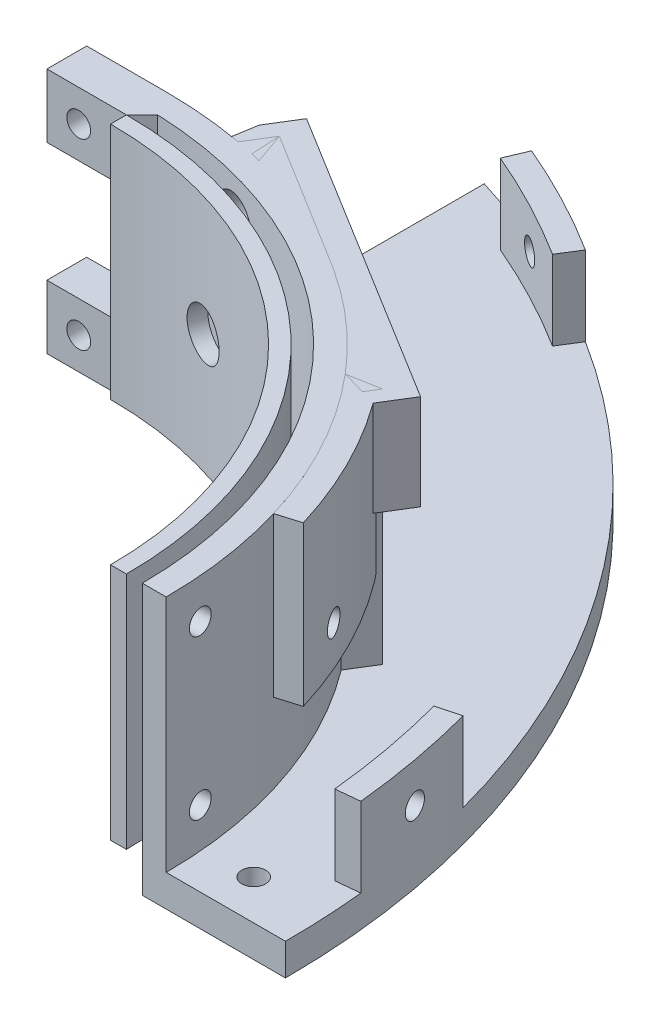
from build123d import *
from build123d.topology import SkipClean

# Parameters (mm, degrees)
BOSS_EXTRUDE1_DEPTH                  = 15
BOSS_EXTRUDE3_DEPTH                  = 15
BOSS_EXTRUDE4_REACH                  = 66.59
BOSS_EXTRUDE4_END_RADIUS             = 52
SKETCH2_R                            = 3.9
BOSS_EXTRUDE4_DIRECTION_2_REACH      = 66.59
BOSS_EXTRUDE4_DIRECTION_2_END_RADIUS = 50
BOSS_EXTRUDE5_REACH                  = 61.954
BOSS_EXTRUDE5_END_RADIUS             = 52
SKETCH4_R                            = 5.6
BOSS_EXTRUDE5_DIRECTION_2_REACH      = 61.954
BOSS_EXTRUDE5_DIRECTION_2_END_RADIUS = 50
CUT_EXTRUDE1_DEPTH                   = 65.589910379
CUT_EXTRUDE1_DEPTH_BACK              = 65.589910379
SKETCH5_R                            = 1.5
SKETCH6_R                            = 3
CUT_EXTRUDE2_DEPTH                   = 65.589910379
CUT_EXTRUDE3_DEPTH                   = 60.953724142
CUT_EXTRUDE3_DEPTH_BACK              = 60.953724142
SKETCH7_R                            = 1.5
SKETCH8_R                            = 3
CUT_EXTRUDE4_DEPTH                   = 60.953724142
BOSS_EXTRUDE6_START                  = -4
BOSS_EXTRUDE6_DEPTH                  = 4
SKETCH12_R                           = 1.5
CUT_EXTRUDE6_DEPTH                   = 92.433035695
BOSS_EXTRUDE7_DEPTH                  = 10
CUT_EXTRUDE10_REACH                  = 106.962
CUT_EXTRUDE10_END_RADIUS             = 96.464285714
SKETCH21_R                           = 1.5
CUT_EXTRUDE11_REACH                  = 106.962
CUT_EXTRUDE11_END_RADIUS             = 96.464285714
SKETCH22_R                           = 1.5
BOSS_EXTRUDE8_DEPTH                  = 20
CUT_EXTRUDE12_REACH                  = 77.845
CUT_EXTRUDE12_END_RADIUS             = 58
SKETCH24_R                           = 1.5
CUT_EXTRUDE13_REACH                  = 92.348
CUT_EXTRUDE13_END_RADIUS             = 58
SKETCH25_R                           = 1.5
BOSS_EXTRUDE9_DEPTH                  = 12
SKETCH28_R                           = 1
CUT_EXTRUDE14_DEPTH                  = 90.439608754
CUT_EXTRUDE15_REACH                  = 93.44
CUT_EXTRUDE15_END_RADIUS             = 55
CUT_EXTRUDE15_START                  = -2
SKETCH29_R                           = 2.5
SKETCH30_W                           = 5
SKETCH30_H                           = 8
BOSS_EXTRUDE10_DEPTH                 = 10
SKETCH31_R                           = 1.5
CUT_EXTRUDE16_DEPTH                  = 5
SKETCH32_R                           = 3
CUT_EXTRUDE17_DEPTH                  = 2
BOSS_EXTRUDE11_START                 = -34
BOSS_EXTRUDE11_DEPTH                 = 34
CUT_EXTRUDE18_DEPTH                  = 87.977008614
SKETCH34_W                           = 20.490980368
SKETCH34_H                           = 15
CUT_EXTRUDE19_DEPTH                  = 90.246848842
FILLET1_R                            = 7.5
CHAMFER1_SIZE                        = 2
SKETCH36_R                           = 1.5
CUT_EXTRUDE20_DEPTH                  = 83.41834451
CUT_EXTRUDE21_REACH                  = 90.764
CUT_EXTRUDE21_END_RADIUS             = 52
SKETCH38_R                           = 1.5
CUT_EXTRUDE22_REACH                  = 93.764
CUT_EXTRUDE22_END_RADIUS             = 52
CUT_EXTRUDE22_START                  = -3
SKETCH39_R                           = 3


# Some blends are built 0.0001 mm under size
with BuildPart() as part:
    # Sketch1 → Boss-Extrude1 (new, symmetric)
    with BuildSketch(Plane(origin=(0, 0, 0), x_dir=(1, 0, 0), z_dir=(0, 1, 0))):
        with BuildLine():
            Line((0, 0), (0, 2))
            ThreePointArc((0, 2), (35.355339059, -12.644660941), (50, -48))
            Line((50, -48), (48, -48))
            ThreePointArc((48, -48), (33.941125497, -14.058874503), (0, 0))
        make_face()
    extrude(amount=BOSS_EXTRUDE1_DEPTH, both=True)

    # Boss-Extrude4: up to this cylinder (the profile starts inside it)
    boss_extrude4_end = Plane(origin=(0, 0, 48), z_dir=(0, -1, 0)) * Cylinder(BOSS_EXTRUDE4_END_RADIUS, 238.18, mode=Mode.PRIVATE)
    # Sketch2 → Boss-Extrude4 (add, up to the surface)
    with BuildSketch(Plane(origin=(14.346758998, 0, 0.1025), x_dir=(-0.9579500000000001, 0, -0.2869351799623044), z_dir=(0.28693517996230433, 0, -0.95795)), mode=Mode.PRIVATE) as boss_extrude4_sk1:
        with Locations(Location((0, 0, 0), (0, 0, 180))):
            Circle(SKETCH2_R)
    boss_extrude4_tool1 = extrude(boss_extrude4_sk1.sketch, amount=BOSS_EXTRUDE4_REACH, mode=Mode.PRIVATE) & boss_extrude4_end
    add(boss_extrude4_tool1.solids().sort_by_distance((14.346759, 0, 0.1025))[0])

    # Boss-Extrude4 direction 2: up to this cylinder (the profile starts outside it)
    with SkipClean():  # the faces are left unmerged after this step: merging them gives an invalid solid
        boss_extrude4_direction_2_end = Plane(origin=(0, 0, 48), z_dir=(0, -1, 0)) * Cylinder(BOSS_EXTRUDE4_DIRECTION_2_END_RADIUS, 234.18, mode=Mode.PRIVATE)
        # Sketch2 → Boss-Extrude4 direction 2 (add, up to the surface)
        with BuildSketch(Plane(origin=(14.346758998, 0, 0.1025), x_dir=(-0.9579500000000001, 0, -0.2869351799623044), z_dir=(0.28693517996230433, 0, -0.95795)), mode=Mode.PRIVATE) as boss_extrude4_direction_2_sk1:
            with Locations(Location((0, 0, 0), (0, 0, 180))):
                Circle(SKETCH2_R)
        boss_extrude4_direction_2_tool1 = extrude(boss_extrude4_direction_2_sk1.sketch, amount=-BOSS_EXTRUDE4_DIRECTION_2_REACH, mode=Mode.PRIVATE) - boss_extrude4_direction_2_end
        add(boss_extrude4_direction_2_tool1.solids().sort_by_distance((14.346759, 0, 0.1025))[0])
        add(boss_extrude4_direction_2_tool1.solids().sort_by_distance((14.346759, 0, 0.1025))[1])

    # Boss-Extrude5: up to this cylinder (the profile starts inside it)
    boss_extrude5_end = Plane(origin=(0, 0, 48), z_dir=(0, -1, 0)) * Cylinder(BOSS_EXTRUDE5_END_RADIUS, 228.908, mode=Mode.PRIVATE)
    # Sketch4 → Boss-Extrude5 (add, up to the surface)
    with BuildSketch(Plane(origin=(46, 0, 28.404082058), x_dir=(-0.3919183588453085, 0, -0.92), z_dir=(0.9199999999999999, 0, -0.39191835884530846)), mode=Mode.PRIVATE) as boss_extrude5_sk1:
        with Locations(Location((0, 0, 0), (0, 0, 180))):
            Circle(SKETCH4_R)
    boss_extrude5_tool1 = extrude(boss_extrude5_sk1.sketch, amount=BOSS_EXTRUDE5_REACH, mode=Mode.PRIVATE) & boss_extrude5_end
    add(boss_extrude5_tool1.solids().sort_by_distance((46, 0, 28.404082))[0])

    # Boss-Extrude5 direction 2: up to this cylinder (the profile starts outside it)
    boss_extrude5_direction_2_end = Plane(origin=(0, 0, 48), z_dir=(0, -1, 0)) * Cylinder(BOSS_EXTRUDE5_DIRECTION_2_END_RADIUS, 224.908, mode=Mode.PRIVATE)
    # Sketch4 → Boss-Extrude5 direction 2 (add, up to the surface)
    with BuildSketch(Plane(origin=(46, 0, 28.404082058), x_dir=(-0.3919183588453085, 0, -0.92), z_dir=(0.9199999999999999, 0, -0.39191835884530846)), mode=Mode.PRIVATE) as boss_extrude5_direction_2_sk1:
        with Locations(Location((0, 0, 0), (0, 0, 180))):
            Circle(SKETCH4_R)
    boss_extrude5_direction_2_tool1 = extrude(boss_extrude5_direction_2_sk1.sketch, amount=-BOSS_EXTRUDE5_DIRECTION_2_REACH, mode=Mode.PRIVATE) - boss_extrude5_direction_2_end
    add(boss_extrude5_direction_2_tool1.solids().sort_by_distance((46, 0, 28.404082))[0])
    add(boss_extrude5_direction_2_tool1.solids().sort_by_distance((46, 0, 28.404082))[1])

    # Sketch5 → Cut-Extrude1 (cut, two sides: drawn at the far end of the back side and taken through both)
    with BuildSketch(Plane(origin=(14.346758998, 0, 0.1025), x_dir=(-0.9579500000000001, 0, -0.2869351799623044), z_dir=(0.28693517996230433, 0, -0.95795)).offset(-CUT_EXTRUDE1_DEPTH_BACK)):
        Circle(SKETCH5_R)
    extrude(amount=CUT_EXTRUDE1_DEPTH + CUT_EXTRUDE1_DEPTH_BACK, mode=Mode.SUBTRACT)

    # Sketch6 → Cut-Extrude2 (cut, through all)
    with BuildSketch(Plane(origin=(14.346758998, 0, 0.1025), x_dir=(-0.9579500000000001, 0, -0.2869351799623044), z_dir=(0.28693517996230433, 0, -0.95795))):
        Circle(SKETCH6_R)
    extrude(amount=-CUT_EXTRUDE2_DEPTH, mode=Mode.SUBTRACT)

    # Sketch7 → Cut-Extrude3 (cut, two sides: drawn at the far end of the back side and taken through both)
    with BuildSketch(Plane(origin=(46, 0, 28.404082058), x_dir=(-0.3919183588453085, 0, -0.92), z_dir=(0.9199999999999999, 0, -0.39191835884530846)).offset(-CUT_EXTRUDE3_DEPTH_BACK)):
        Circle(SKETCH7_R)
    extrude(amount=CUT_EXTRUDE3_DEPTH + CUT_EXTRUDE3_DEPTH_BACK, mode=Mode.SUBTRACT)

    # Sketch8 → Cut-Extrude4 (cut, through all)
    with BuildSketch(Plane(origin=(46, 0, 28.404082058), x_dir=(-0.3919183588453085, 0, -0.92), z_dir=(0.9199999999999999, 0, -0.39191835884530846))):
        Circle(SKETCH8_R)
    extrude(amount=-CUT_EXTRUDE4_DEPTH, mode=Mode.SUBTRACT)


with BuildPart() as body_2:
    # Sketch3 → Boss-Extrude3 (new, symmetric)
    with BuildSketch(Plane(origin=(0, 0, 0), x_dir=(1, 0, 0), z_dir=(0, 1, 0))):
        with BuildLine():
            Line((0, 4), (0, 7))
            ThreePointArc((0, 7), (38.890872965, -9.109127035), (55, -48))
            Line((55, -48), (52, -48))
            ThreePointArc((52, -48), (36.769552622, -11.230447378), (0, 4))
        make_face()
    extrude(amount=BOSS_EXTRUDE3_DEPTH, both=True)

    # Sketch9 → Boss-Extrude6 (add)
    with BuildSketch(Plane(origin=(0, -15, 0), x_dir=(1, 0, 0), z_dir=(0, 1, 0)).offset(BOSS_EXTRUDE6_START)):
        with BuildLine():
            Line((0, 4), (0, 47))
            ThreePointArc((0, 47), (50.610018108, 11.002118606), (70, -48))
            Line((70, -48), (52, -48))
            ThreePointArc((52, -48), (36.769552622, -11.230447378), (0, 4))
        make_face()
    extrude(amount=BOSS_EXTRUDE6_DEPTH)

    # Sketch12 → Cut-Extrude6 (cut, through all)
    with BuildSketch(Plane(origin=(0, -19, 0), x_dir=(1, 0, 0), z_dir=(0, 1, 0))):
        with Locations(Location((5, 25.5, 0), (0, 0, 90))):
            Circle(SKETCH12_R)
        with Locations(Location((61, -43, 0), (0, 0, 90))):
            Circle(SKETCH12_R)
    extrude(amount=CUT_EXTRUDE6_DEPTH, mode=Mode.SUBTRACT)

    # Sketch19 → Boss-Extrude7 (add)
    with BuildSketch(Plane.XZ.offset(15)):
        with BuildLine():
            Line((69.497307002, 38.012643005), (66.512469017, 38.313877471))
            ThreePointArc((66.512469017, 38.313877471), (65.422459077, 30.625763866), (63.717618824, 23.050228757))
            Line((63.717618824, 23.050228757), (66.615538106, 22.274301033))
            ThreePointArc((66.615538106, 22.274301033), (68.373398197, 30.085432198), (69.497307002, 38.012643005))
        make_face()
        with BuildLine():
            Line((8.218266739, -40.799682764), (9.390178773, -43.561316734))
            ThreePointArc((9.390178773, -43.561316734), (16.628654889, -40.139576577), (23.568466137, -36.146725211))
            Line((23.568466137, -36.146725211), (21.968914555, -33.608727036))
            ThreePointArc((21.968914555, -33.608727036), (15.238418979, -37.481147696), (8.218266739, -40.799682764))
        make_face()
    extrude(amount=-BOSS_EXTRUDE7_DEPTH)

    # Cut-Extrude10: up to this cylinder (the profile starts outside it)
    cut_extrude10_end = Plane(origin=(-29.464285714, -10, 48), z_dir=(0, -1, 0)) * Cylinder(CUT_EXTRUDE10_END_RADIUS, 407.852571429, mode=Mode.PRIVATE)
    # Sketch21 → Cut-Extrude10 (cut, up to the surface)
    with BuildSketch(Plane(origin=(16.628654889, -5, -40.139576577), x_dir=(-0.8861429602003462, 0, -0.463411970159779), z_dir=(0.463411970159779, 0, -0.8861429602003462)), mode=Mode.PRIVATE) as cut_extrude10_sk1:
        with Locations((0, -5)):
            Circle(SKETCH21_R)
    cut_extrude10_tool1 = extrude(cut_extrude10_sk1.sketch, amount=-CUT_EXTRUDE10_REACH, mode=Mode.PRIVATE) - cut_extrude10_end
    add(cut_extrude10_tool1.solids().sort_by_distance((16.628655, -10, -40.139577))[0], mode=Mode.SUBTRACT)

    # Cut-Extrude11: up to this cylinder (the profile starts outside it)
    cut_extrude11_end = Plane(origin=(-29.464285714, -10, 48), z_dir=(0, -1, 0)) * Cylinder(CUT_EXTRUDE11_END_RADIUS, 407.852571429, mode=Mode.PRIVATE)
    # Sketch22 → Cut-Extrude11 (cut, up to the surface)
    with BuildSketch(Plane(origin=(68.373398197, -5, 30.085432198), x_dir=(-0.18011055599990136, 0, -0.9836463732548434), z_dir=(0.9836463732548434, 0, -0.18011055599990136)), mode=Mode.PRIVATE) as cut_extrude11_sk1:
        with Locations((0, -5)):
            Circle(SKETCH22_R)
    cut_extrude11_tool1 = extrude(cut_extrude11_sk1.sketch, amount=-CUT_EXTRUDE11_REACH, mode=Mode.PRIVATE) - cut_extrude11_end
    add(cut_extrude11_tool1.solids().sort_by_distance((68.373398, -10, 30.085432))[0], mode=Mode.SUBTRACT)

    # Sketch30 → Boss-Extrude10 (add)
    with BuildSketch(Plane.ZY):
        with Locations((-4.5, 11)):
            Rectangle(SKETCH30_W, SKETCH30_H)
        with Locations((-4.5, -12)):
            Rectangle(SKETCH30_W, SKETCH30_H)
    extrude(amount=BOSS_EXTRUDE10_DEPTH)

    # Sketch31 → Cut-Extrude16 (cut)
    with BuildSketch(Plane(origin=(0, 0, -7), x_dir=(-1, 0, 0), z_dir=(0, 0, -1))):
        with Locations((6, 11)):
            Circle(SKETCH31_R)
        with Locations((6, -12)):
            Circle(SKETCH31_R)
    extrude(amount=-CUT_EXTRUDE16_DEPTH, mode=Mode.SUBTRACT)

    # Sketch32 → Cut-Extrude17 (cut)
    with BuildSketch(Plane(origin=(0, 0, -7), x_dir=(-1, 0, 0), z_dir=(0, 0, -1))):
        with Locations((6, 11)):
            Circle(SKETCH32_R)
        with Locations((6, -12)):
            Circle(SKETCH32_R)
    extrude(amount=-CUT_EXTRUDE17_DEPTH, mode=Mode.SUBTRACT)

    # Sketch37 → Boss-Extrude11 (add)
    with BuildSketch(Plane(origin=(0, 15, 0), x_dir=(1, 0, 0), z_dir=(0, 1, 0)).offset(BOSS_EXTRUDE11_START)):
        with BuildLine():
            Line((45.952291522, -11.759319765), (28.946256445, -1.233406818))
            ThreePointArc((28.946256445, -1.233406818), (37.098925323, -7.396185649), (43.97065903, -14.960914897))
            Line((43.97065903, -14.960914897), (45.952291522, -11.759319765))
        make_face()
        with BuildLine():
            Line((28.946256445, -1.233406818), (11.940224446, 9.292504223))
            Line((11.940224446, 9.292504223), (9.958591955, 6.090909091))
            ThreePointArc((9.958591955, 6.090909091), (19.794145804, 3.31463526), (28.946256445, -1.233406818))
        make_face()
    extrude(amount=BOSS_EXTRUDE11_DEPTH)

    # Sketch33 → Cut-Extrude18 (cut, through all)
    with BuildSketch(Plane.ZY):
        Polygon((-7, 7), (-4, 7), (-4, -8), (-7, -8), (-9.292504223, -8), (-9.292504223, 7), align=None)
    extrude(amount=-CUT_EXTRUDE18_DEPTH, mode=Mode.SUBTRACT)

    # Sketch34 → Cut-Extrude19 (cut, through all)
    with BuildSketch(Plane(origin=(0, 0, -4), x_dir=(-1, 0, 0), z_dir=(0, 0, -1))):
        with Locations((-10.245490184, -0.5)):
            Rectangle(SKETCH34_W, SKETCH34_H)
    extrude(amount=-CUT_EXTRUDE19_DEPTH, mode=Mode.SUBTRACT)

    # Fillet1
    fillet1_edges = [body_2.edges().sort_by_distance(p)[0] for p in [
        (20.490980368, 7, -1.896232567),
        (20.490980368, -8, -1.896232567),
    ]]
    fillet(fillet1_edges, radius=FILLET1_R - 0.0001)  # a hair under: the kernel refuses the full size

    # Chamfer1
    # the kernel refuses this chamfer: 2 mm, written as the material it adds along each edge
    with BuildSketch(Plane(origin=(0, -16, -4), x_dir=(0.9998217991483124, -5.3084090101683784e-15, 0.018877763316446326), z_dir=(0, 1, 0)), Plane(origin=(0, 7, -4), x_dir=(0.9998217991483123, -5.3084090101683784e-15, 0.01887776331644899), z_dir=(0, 1, 0))) as chamfer1_piece_1:
        with BuildLine():
            Line((1.963287385, 0), (CHAMFER1_SIZE * 0.0188777633165, -CHAMFER1_SIZE * 0.999821799148))
            Line((CHAMFER1_SIZE * 0.0188777633165, -CHAMFER1_SIZE * 0.999821799148), (0, 0))
            ThreePointArc((0, 0), (1.00937855, 0.009259048), (1.963287385, 0))
        make_face()
    extrude(amount=8)

    # Sketch36 → Cut-Extrude20 (cut, through all)
    with BuildSketch(Plane(origin=(50.907994954, 0, -4.172786472), x_dir=(-0.08169323944527147, 0, -0.9966575212323125), z_dir=(0.9966575212323127, 0, -0.08169323944527147))):
        with Locations((-47.839561019, 10)):
            Circle(SKETCH36_R)
        with Locations((-47.839561019, -10)):
            Circle(SKETCH36_R)
    extrude(amount=-CUT_EXTRUDE20_DEPTH, mode=Mode.SUBTRACT)

    # Cut-Extrude21: up to this cylinder (the profile starts outside it)
    cut_extrude21_end = Plane(origin=(0, 0, 48), z_dir=(0, -1, 0)) * Cylinder(CUT_EXTRUDE21_END_RADIUS, 306.528, mode=Mode.PRIVATE)
    # Sketch38 → Cut-Extrude21 (cut, up to the surface)
    with BuildSketch(Plane(origin=(7.465776497, 0, -12.061971026), x_dir=(-0.8503016768958407, 0, -0.526295599704312), z_dir=(0.526295599704312, 0, -0.8503016768958407)), mode=Mode.PRIVATE) as cut_extrude21_sk1:
        with Locations((-40.262188786, 10)):
            Circle(SKETCH38_R)
    cut_extrude21_tool1 = extrude(cut_extrude21_sk1.sketch, amount=-CUT_EXTRUDE21_REACH, mode=Mode.PRIVATE) - cut_extrude21_end
    add(cut_extrude21_tool1.solids().sort_by_distance((41.700783, 10, 9.127842))[0], mode=Mode.SUBTRACT)
    # Sketch38 → Cut-Extrude21 (cut, up to the surface)
    with BuildSketch(Plane(origin=(7.465776497, 0, -12.061971026), x_dir=(-0.8503016768958407, 0, -0.526295599704312), z_dir=(0.526295599704312, 0, -0.8503016768958407)), mode=Mode.PRIVATE) as cut_extrude21_sk2:
        with Locations((-10.262188786, 10)):
            Circle(SKETCH38_R)
    cut_extrude21_tool2 = extrude(cut_extrude21_sk2.sketch, amount=-CUT_EXTRUDE21_REACH, mode=Mode.PRIVATE) - cut_extrude21_end
    add(cut_extrude21_tool2.solids().sort_by_distance((16.191733, 10, -6.661026))[0], mode=Mode.SUBTRACT)
    # Sketch38 → Cut-Extrude21 (cut, up to the surface)
    with BuildSketch(Plane(origin=(7.465776497, 0, -12.061971026), x_dir=(-0.8503016768958407, 0, -0.526295599704312), z_dir=(0.526295599704312, 0, -0.8503016768958407)), mode=Mode.PRIVATE) as cut_extrude21_sk3:
        with Locations((-10.262188786, -10)):
            Circle(SKETCH38_R)
    cut_extrude21_tool3 = extrude(cut_extrude21_sk3.sketch, amount=-CUT_EXTRUDE21_REACH, mode=Mode.PRIVATE) - cut_extrude21_end
    add(cut_extrude21_tool3.solids().sort_by_distance((16.191733, -10, -6.661026))[0], mode=Mode.SUBTRACT)
    # Sketch38 → Cut-Extrude21 (cut, up to the surface)
    with BuildSketch(Plane(origin=(7.465776497, 0, -12.061971026), x_dir=(-0.8503016768958407, 0, -0.526295599704312), z_dir=(0.526295599704312, 0, -0.8503016768958407)), mode=Mode.PRIVATE) as cut_extrude21_sk4:
        with Locations((-40.262188786, -10)):
            Circle(SKETCH38_R)
    cut_extrude21_tool4 = extrude(cut_extrude21_sk4.sketch, amount=-CUT_EXTRUDE21_REACH, mode=Mode.PRIVATE) - cut_extrude21_end
    add(cut_extrude21_tool4.solids().sort_by_distance((41.700783, -10, 9.127842))[0], mode=Mode.SUBTRACT)

    # Cut-Extrude22: up to this cylinder (the profile starts outside it)
    cut_extrude22_end = Plane(origin=(0, 0, 48), z_dir=(0, -1, 0)) * Cylinder(CUT_EXTRUDE22_END_RADIUS, 312.528, mode=Mode.PRIVATE)
    # Sketch39 → Cut-Extrude22 (cut, up to the surface)
    with BuildSketch(Plane(origin=(7.465776497, 0, -12.061971026), x_dir=(-0.8503016768958407, 0, -0.526295599704312), z_dir=(0.526295599704312, 0, -0.8503016768958407)).offset(CUT_EXTRUDE22_START), mode=Mode.PRIVATE) as cut_extrude22_sk1:
        with Locations((-10.262188786, 10)):
            Circle(SKETCH39_R)
    cut_extrude22_tool1 = extrude(cut_extrude22_sk1.sketch, amount=-CUT_EXTRUDE22_REACH, mode=Mode.PRIVATE) - cut_extrude22_end
    add(cut_extrude22_tool1.solids().sort_by_distance((14.612846, 10, -4.110121))[0], mode=Mode.SUBTRACT)
    # Sketch39 → Cut-Extrude22 (cut, up to the surface)
    with BuildSketch(Plane(origin=(7.465776497, 0, -12.061971026), x_dir=(-0.8503016768958407, 0, -0.526295599704312), z_dir=(0.526295599704312, 0, -0.8503016768958407)).offset(CUT_EXTRUDE22_START), mode=Mode.PRIVATE) as cut_extrude22_sk2:
        with Locations((-10.262188786, -10)):
            Circle(SKETCH39_R)
    cut_extrude22_tool2 = extrude(cut_extrude22_sk2.sketch, amount=-CUT_EXTRUDE22_REACH, mode=Mode.PRIVATE) - cut_extrude22_end
    add(cut_extrude22_tool2.solids().sort_by_distance((14.612846, -10, -4.110121))[0], mode=Mode.SUBTRACT)
    # Sketch39 → Cut-Extrude22 (cut, up to the surface)
    with BuildSketch(Plane(origin=(7.465776497, 0, -12.061971026), x_dir=(-0.8503016768958407, 0, -0.526295599704312), z_dir=(0.526295599704312, 0, -0.8503016768958407)).offset(CUT_EXTRUDE22_START), mode=Mode.PRIVATE) as cut_extrude22_sk3:
        with Locations((-40.262188786, -10)):
            Circle(SKETCH39_R)
    cut_extrude22_tool3 = extrude(cut_extrude22_sk3.sketch, amount=-CUT_EXTRUDE22_REACH, mode=Mode.PRIVATE) - cut_extrude22_end
    add(cut_extrude22_tool3.solids().sort_by_distance((40.121896, -10, 11.678747))[0], mode=Mode.SUBTRACT)
    # Sketch39 → Cut-Extrude22 (cut, up to the surface)
    with BuildSketch(Plane(origin=(7.465776497, 0, -12.061971026), x_dir=(-0.8503016768958407, 0, -0.526295599704312), z_dir=(0.526295599704312, 0, -0.8503016768958407)).offset(CUT_EXTRUDE22_START), mode=Mode.PRIVATE) as cut_extrude22_sk4:
        with Locations((-40.262188786, 10)):
            Circle(SKETCH39_R)
    cut_extrude22_tool4 = extrude(cut_extrude22_sk4.sketch, amount=-CUT_EXTRUDE22_REACH, mode=Mode.PRIVATE) - cut_extrude22_end
    add(cut_extrude22_tool4.solids().sort_by_distance((40.121896, 10, 11.678747))[0], mode=Mode.SUBTRACT)


with BuildPart() as body_3:
    # Sketch23 → Boss-Extrude8 (new body)
    with BuildSketch(Plane(origin=(0, 15, 0), x_dir=(1, 0, 0), z_dir=(0, 1, 0))):
        with BuildLine():
            Line((8.96982545, 6.263636364), (9.459088656, 9.223471074))
            ThreePointArc((9.459088656, 9.223471074), (38.302511734, -4.446382528), (55.545785124, -31.306715273))
            Line((55.545785124, -31.306715273), (52.672727273, -32.170161035))
            ThreePointArc((52.672727273, -32.170161035), (36.321347334, -6.699155846), (8.96982545, 6.263636364))
        make_face()
    extrude(amount=-BOSS_EXTRUDE8_DEPTH)

    # Cut-Extrude12: up to this cylinder (the profile starts inside it)
    cut_extrude12_end = Plane(origin=(0, 0, 48), z_dir=(0, 1, 0)) * Cylinder(CUT_EXTRUDE12_END_RADIUS, 272.69, mode=Mode.PRIVATE)
    # Sketch24 → Cut-Extrude12 (cut, up to the surface)
    with BuildSketch(Plane(origin=(14.346758998, 0, 0.1025), x_dir=(-0.9579500000000001, 0, -0.2869351799623044), z_dir=(0.28693517996230433, 0, -0.95795)), mode=Mode.PRIVATE) as cut_extrude12_sk1:
        with Locations(Location((0, 0, 0), (0, 0, 180))):
            Circle(SKETCH24_R)
    cut_extrude12_tool1 = extrude(cut_extrude12_sk1.sketch, amount=CUT_EXTRUDE12_REACH, mode=Mode.PRIVATE) & cut_extrude12_end
    add(cut_extrude12_tool1.solids().sort_by_distance((14.346759, 0, 0.1025))[0], mode=Mode.SUBTRACT)

    # Cut-Extrude13: up to this cylinder (the profile starts inside it)
    cut_extrude13_end = Plane(origin=(0, 0, 48), z_dir=(0, 1, 0)) * Cylinder(CUT_EXTRUDE13_END_RADIUS, 301.696, mode=Mode.PRIVATE)
    # Sketch25 → Cut-Extrude13 (cut, up to the surface)
    with BuildSketch(Plane(origin=(46, 0, 28.404082058), x_dir=(-0.3919183588453085, 0, -0.92), z_dir=(0.9199999999999999, 0, -0.39191835884530846)), mode=Mode.PRIVATE) as cut_extrude13_sk1:
        with Locations(Location((0, 0, 0), (0, 0, 180))):
            Circle(SKETCH25_R)
    cut_extrude13_tool1 = extrude(cut_extrude13_sk1.sketch, amount=CUT_EXTRUDE13_REACH, mode=Mode.PRIVATE) & cut_extrude13_end
    add(cut_extrude13_tool1.solids().sort_by_distance((46, 0, 28.404082))[0], mode=Mode.SUBTRACT)

    # Sketch26 → Boss-Extrude9 (add)
    with BuildSketch(Plane(origin=(0, 15, 0), x_dir=(1, 0, 0), z_dir=(0, 1, 0))):
        with BuildLine():
            Line((49.180117065, -10.193703097), (30.457660935, 1.359202692))
            ThreePointArc((30.457660935, 1.359202692), (39.424394073, -5.459229532), (46.904001082, -13.882340606))
            Line((46.904001082, -13.882340606), (49.180117065, -10.193703097))
        make_face()
        with BuildLine():
            Line((30.457660935, 1.359202692), (11.735204639, 12.912108584))
            Line((11.735204639, 12.912108584), (9.459088656, 9.223471074))
            ThreePointArc((9.459088656, 9.223471074), (20.342035389, 6.315758268), (30.457660935, 1.359202692))
        make_face()
    extrude(amount=-BOSS_EXTRUDE9_DEPTH)

    # Sketch28 → Cut-Extrude14 (cut, through all)
    with BuildSketch(Plane(origin=(9.006542796, 0, -14.595860597), x_dir=(-0.8510207369531109, 0, -0.5251320836473278), z_dir=(0.5251320836473278, 0, -0.8510207369531109))):
        with Locations((-41.456340015, 7)):
            Circle(SKETCH28_R)
        with Locations((-8.956340015, 7)):
            Circle(SKETCH28_R)
    extrude(amount=-CUT_EXTRUDE14_DEPTH, mode=Mode.SUBTRACT)

    # Cut-Extrude15: up to this cylinder (the profile starts outside it)
    cut_extrude15_end = Plane(origin=(0, 7, 48), z_dir=(0, 1, 0)) * Cylinder(CUT_EXTRUDE15_END_RADIUS, 297.88, mode=Mode.PRIVATE)
    # Sketch29 → Cut-Extrude15 (cut, up to the surface)
    with BuildSketch(Plane(origin=(9.006542796, 0, -14.595860597), x_dir=(-0.851020736953111, 0, -0.5251320836473279), z_dir=(0.5251320836473279, 0, -0.851020736953111)).offset(CUT_EXTRUDE15_START), mode=Mode.PRIVATE) as cut_extrude15_sk1:
        with Locations((-41.456340015, 7)):
            Circle(SKETCH29_R)
    cut_extrude15_tool1 = extrude(cut_extrude15_sk1.sketch, amount=-CUT_EXTRUDE15_REACH, mode=Mode.PRIVATE) - cut_extrude15_end
    add(cut_extrude15_tool1.solids().sort_by_distance((43.236484, 7, 8.876235))[0], mode=Mode.SUBTRACT)
    # Sketch29 → Cut-Extrude15 (cut, up to the surface)
    with BuildSketch(Plane(origin=(9.006542796, 0, -14.595860597), x_dir=(-0.851020736953111, 0, -0.5251320836473279), z_dir=(0.5251320836473279, 0, -0.851020736953111)).offset(CUT_EXTRUDE15_START), mode=Mode.PRIVATE) as cut_extrude15_sk2:
        with Locations((-8.956340015, 7)):
            Circle(SKETCH29_R)
    cut_extrude15_tool2 = extrude(cut_extrude15_sk2.sketch, amount=-CUT_EXTRUDE15_REACH, mode=Mode.PRIVATE) - cut_extrude15_end
    add(cut_extrude15_tool2.solids().sort_by_distance((15.57831, 7, -8.190558))[0], mode=Mode.SUBTRACT)


solid = Compound([part.part, body_2.part, body_3.part])
